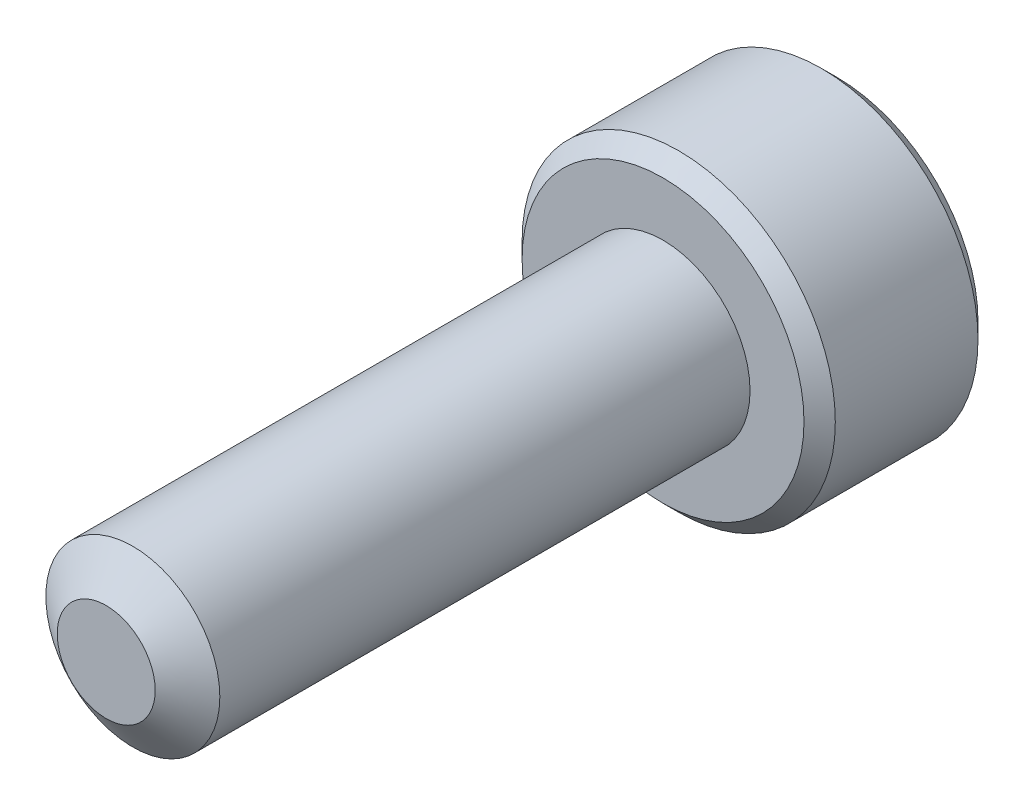
from build123d import *

# Parameters (mm, degrees)
SKETCH1_R          = 1.25
EXTRUDE1_DEPTH     = 8
SKETCH6_R          = 2.25
EXTRUDE2_DEPTH     = 2.5
CUT_EXTRUDE1_DEPTH = 1.5
CHAMFER1_SIZE      = 0.225


with BuildPart() as part:
    # Sketch1 → Extrude1 (new body)
    with BuildSketch(Plane.XY):
        Circle(SKETCH1_R)
    extrude(amount=-EXTRUDE1_DEPTH)

    # Sketch4 → Cut-Revolve1 (revolve, cut)
    with BuildSketch(Plane(origin=(0, 0, 0), x_dir=(0, 0, -1), z_dir=(1, 0, 0))):
        Polygon((0.382511876, 1.25), (0, 0.703716426), (0, 1.25), align=None)
    revolve(axis=Axis((0, 0, 0), (0, 0, -1)), mode=Mode.SUBTRACT)

    # Sketch6 → Extrude2 (add)
    with BuildSketch(Plane(origin=(0, 0, -8), x_dir=(-1, 0, 0), z_dir=(0, 0, -1))):
        Circle(SKETCH6_R)
    extrude(amount=EXTRUDE2_DEPTH)

    # Sketch7 → Cut-Extrude1 (cut)
    with BuildSketch(Plane(origin=(0, 0, -10.5), x_dir=(-1, 0, 0), z_dir=(0, 0, -1))):
        Polygon((0, 1.154700538), (-1, 0.577350269), (-1, -0.577350269), (0, -1.154700538), (1, -0.577350269), (1, 0.577350269), align=None)
    extrude(amount=-CUT_EXTRUDE1_DEPTH, mode=Mode.SUBTRACT)

    # Cut-Extrude2 cone 1 section (through the dimple's axis) → Cut-Extrude2 (revolve, cut)
    with BuildSketch(Plane(origin=(0, 0, -10.5), x_dir=(0, 1, 0), z_dir=(1, 0, 0))):
        Polygon((0, 0), (1.154700538, 0), (0, 1.154700538), align=None)
    revolve(axis=Axis((0, 0, -10.5), (0, 0, 1)), mode=Mode.SUBTRACT)

    # Chamfer1
    chamfer1_edges = [part.edges().sort_by_distance(p)[0] for p in [
        (2.25, 0, -10.5),
        (2.25, 0, -8),
    ]]
    chamfer(chamfer1_edges, length=CHAMFER1_SIZE)


solid = part.part
